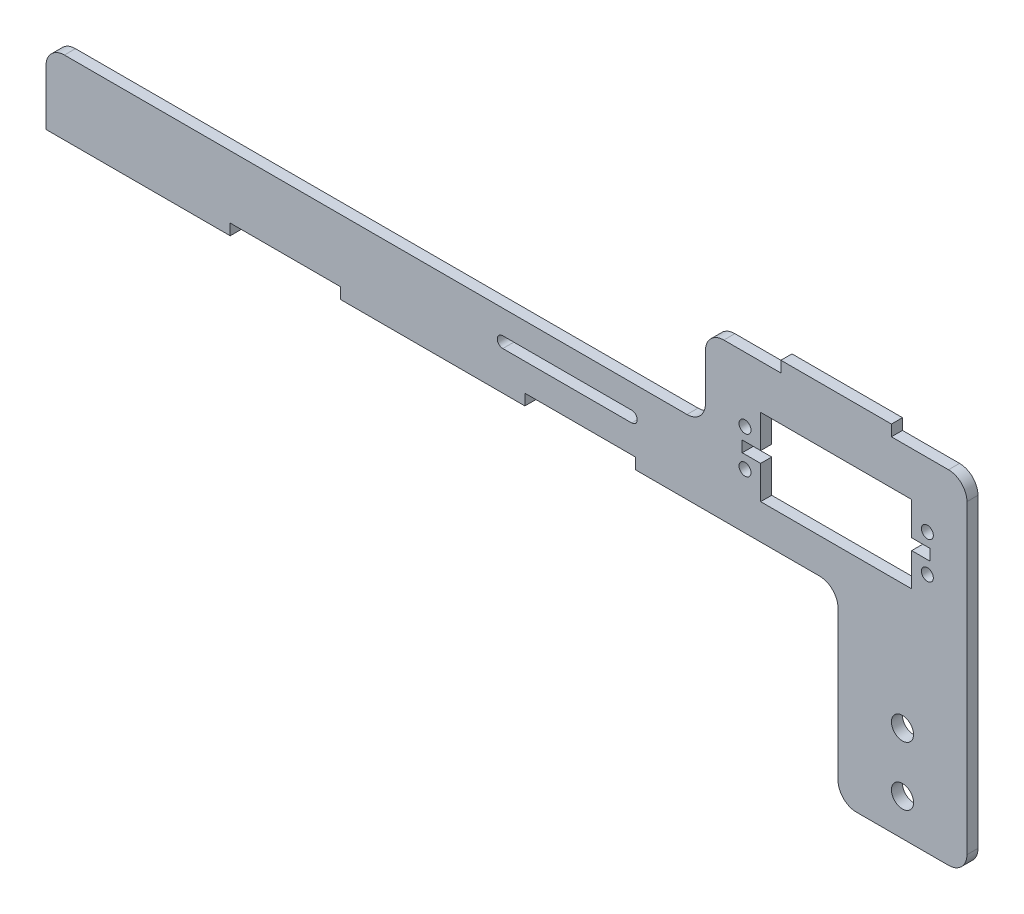
from build123d import *

# Parameters (mm, degrees)
ESBO_O1_R                = 3
ESBO_O1_R_2              = 1.625
RESSALTO_EXTRUS_O1_DEPTH = 3
FILETE1_R                = 5


with BuildPart() as part:
    # Esboço1 → Ressalto-extrusão1 (new body)
    with BuildSketch(Plane.XY):
        Polygon((160, -20), (215, -20), (215, -70.5), (250, -70.5), (250, 22.5), (229.5, 22.5), (229.5, 25.5), (199.5, 25.5), (199.5, 22.5), (179, 22.5), (179, 0), (0, 0), (0, -20), (50, -20), (50, -17), (80, -17), (80, -20), (130, -20), (130, -17), (160, -17), align=None)
        with Locations((232.5, -60.5)):
            Circle(ESBO_O1_R, mode=Mode.SUBTRACT)
        with Locations((232.5, -44.5)):
            Circle(ESBO_O1_R, mode=Mode.SUBTRACT)
        with BuildLine():
            ThreePointArc((124, -9.5), (122.5, -8), (124, -6.5))
            Line((124, -6.5), (159, -6.5))
            ThreePointArc((159, -6.5), (160.5, -8), (159, -9.5))
            Line((159, -9.5), (124, -9.5))
        make_face(mode=Mode.SUBTRACT)
        with Locations((189.75, -5)):
            Circle(ESBO_O1_R_2, mode=Mode.SUBTRACT)
        Polygon((194, 1.5), (194, 10.5), (235, 10.5), (235, 1.5), (240, 1.5), (240, -1.5), (235, -1.5), (235, -10.5), (194, -10.5), (194, -1.5), (189, -1.5), (189, 1.5), align=None, mode=Mode.SUBTRACT)
        with Locations((239.25, -5)):
            Circle(ESBO_O1_R_2, mode=Mode.SUBTRACT)
        with Locations((189.75, 5)):
            Circle(ESBO_O1_R_2, mode=Mode.SUBTRACT)
        with Locations((239.25, 5)):
            Circle(ESBO_O1_R_2, mode=Mode.SUBTRACT)
    extrude(amount=RESSALTO_EXTRUS_O1_DEPTH)

    # Filete1
    filete1_edges = [part.edges().sort_by_distance(p)[0] for p in [
        (215, -20, 1.5),
        (215, -70.5, 1.5),
        (250, -70.5, 1.5),
        (179, 0, 1.5),
        (0, 0, 1.5),
        (179, 22.5, 1.5),
        (250, 22.5, 1.5),
    ]]
    fillet(filete1_edges, radius=FILETE1_R)


solid = part.part
